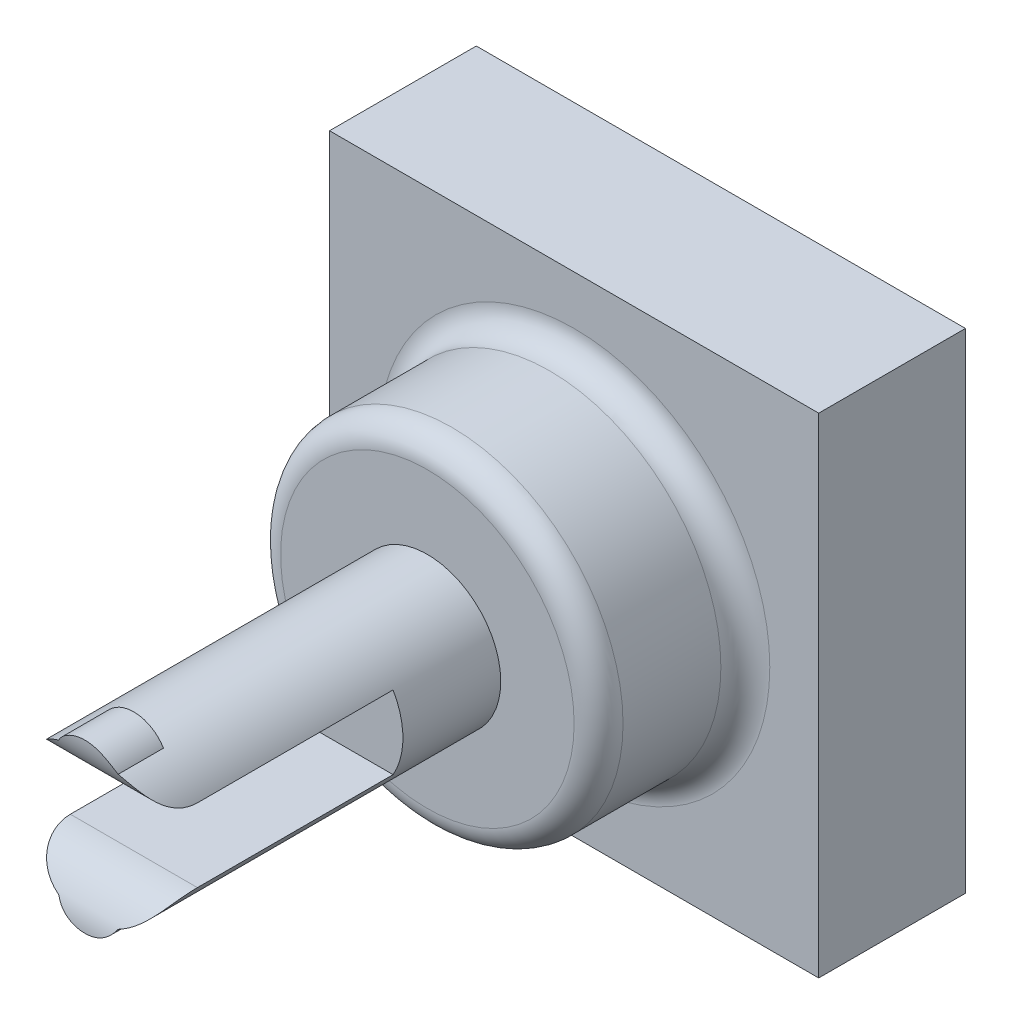
from build123d import *

# Parameters (mm, degrees)
ESQUISSE1_W             = 10
ESQUISSE1_H             = 10
BOSS_EXTRU_1_DEPTH      = 3
ESQUISSE2_R             = 3.5
BOSS_EXTRU_2_DEPTH      = 3
ESQUISSE5_R             = 1.5
BOSS_EXTRU_4_DEPTH      = 7
BOSS_EXTRU_5_DEPTH      = 1
ENL_V_MAT_EXTRU_1_DEPTH = 5
CONG_1_R                = 1
CONG_5_R                = 0.5


with BuildPart() as part:
    # Esquisse1 → Boss.-Extru.1 (new body)
    with BuildSketch(Plane.XY):
        Rectangle(ESQUISSE1_W, ESQUISSE1_H)
    extrude(amount=BOSS_EXTRU_1_DEPTH)

    # Esquisse2 → Boss.-Extru.2 (add)
    with BuildSketch(Plane.XY.offset(3)):
        with Locations(Location((0, 0, 0), (0, 0, 180))):
            Circle(ESQUISSE2_R)
    extrude(amount=BOSS_EXTRU_2_DEPTH)

    # Esquisse5 → Boss.-Extru.4 (add)
    with BuildSketch(Plane.XY.offset(6)):
        Circle(ESQUISSE5_R)
    extrude(amount=BOSS_EXTRU_4_DEPTH)

    # Esquisse6 → Boss.-Extru.5 (add)
    with BuildSketch(Plane.XY.offset(13)):
        with BuildLine():
            Line((-0.710860958, -1), (-0.710860958, 1))
            ThreePointArc((-0.710860958, 1), (0, 1.710860958), (0.710860958, 1))
            Line((0.710860958, 1), (0.710860958, -1))
            ThreePointArc((0.710860958, -1), (0, -1.710860958), (-0.710860958, -1))
        make_face()
    extrude(amount=-BOSS_EXTRU_5_DEPTH)

    # Esquisse7 → Enlèv. mat.-Extru.1 (cut)
    with BuildSketch(Plane.XY.offset(13)):
        with BuildLine():
            Line((1.624079267, -0.75), (-1.624079267, -0.75))
            ThreePointArc((-1.624079267, -0.75), (-2.374079267, 0), (-1.624079267, 0.75))
            Line((-1.624079267, 0.75), (1.624079267, 0.75))
            ThreePointArc((1.624079267, 0.75), (2.374079267, 0), (1.624079267, -0.75))
        make_face()
    extrude(amount=-ENL_V_MAT_EXTRU_1_DEPTH, mode=Mode.SUBTRACT)

    # Congé1
    # the kernel refuses this fillet: 1 mm, written as the material it takes off along each edge
    with BuildSketch(Plane(origin=(-3.799038106, 0.75, 13), x_dir=(0, 0, -1), z_dir=(1, 0, 0)), Plane(origin=(3.799038106, -0.75, 13), x_dir=(0, 0, -1), z_dir=(-1, 0, 0))) as cong_1_piece_1:
        with BuildLine():
            CenterArc((CONG_1_R, CONG_1_R), CONG_1_R, 180, 90)
            Line((0, CONG_1_R), (0, 0))
            Line((0, 0), (CONG_1_R, 0))
        make_face()
    extrude(amount=7.598076211, mode=Mode.SUBTRACT)

    # Congé5
    cong_5_edges = [part.edges().sort_by_distance(p)[0] for p in [
        (3.5, 0, 3),
        (3.5, 0, 6),
    ]]
    fillet(cong_5_edges, radius=CONG_5_R)


solid = part.part
